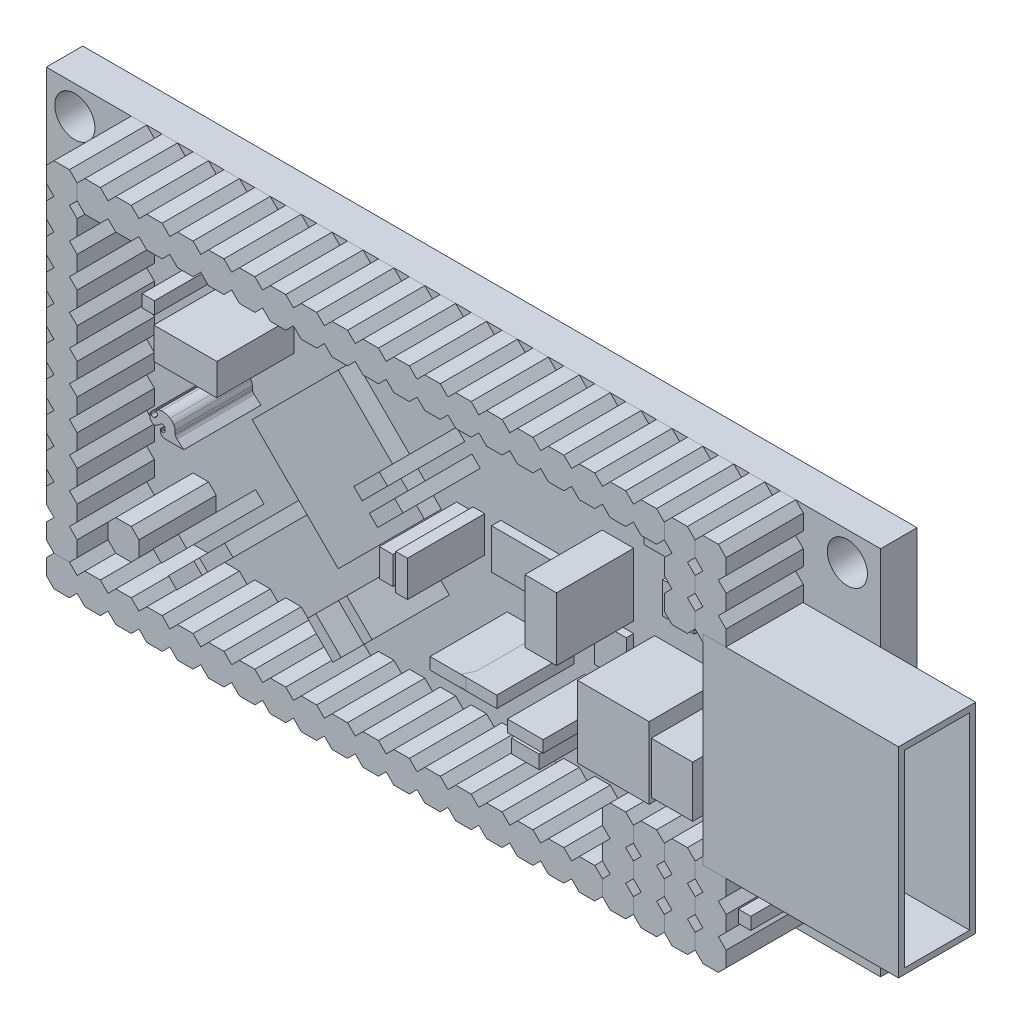
from build123d import *

# Parameters (mm, degrees)
SKETCH_1_W                    = 68.58
SKETCH_1_H                    = 30.48
BOARD_DEPTH                   = 3
F_0402_CAP_1_DEPTH            = 6.35
F_0402_CAP_2_DEPTH            = 6.35
F_0402_CAP_3_DEPTH            = 6.35
F_0402_CAP_4_DEPTH            = 6.35
F_0402_CAP_5_DEPTH            = 6.35
SKETCH_7_W                    = 2.5908
SKETCH_7_H                    = 3.2004
EXTRUDE_1210_1_DEPTH          = 0.6096
SKETCH_8_W                    = 5.1816
SKETCH_8_H                    = 2.5908
EIA3216_1_DEPTH               = 6.35
SKETCH_9_W                    = 2.5908
SKETCH_9_H                    = 5.1816
EIA3216_2_DEPTH               = 6.35
SKETCH_10_W                   = 2.5908
SKETCH_10_H                   = 3.2004
EXTRUDE_1210_2_DEPTH          = 0.6096
SKETCH_11_W                   = 2.5908
SKETCH_11_H                   = 1.3716
EXTRUDE_0805_1_DEPTH          = 0.6096
SKETCH_12_W                   = 6.5532
SKETCH_12_H                   = 3.302
SOT223_1_DEPTH                = 0.762
EXTRUDE_1X19_1_DEPTH          = 6.35
EXTRUDE_1X03_1_DEPTH          = 6.35
EXTRUDE_1X03_2_DEPTH          = 6.35
EXTRUDE_1X03_3_DEPTH          = 6.35
EXTRUDE_1X03_4_DEPTH          = 6.35
EXTRUDE_1X03_5_DEPTH          = 6.35
SKETCH_19_W                   = 1.016
SKETCH_19_H                   = 1.016
FIDUCIAL_1X2_1_DEPTH          = 6.35
EXTRUDE_1X18_1_DEPTH          = 6.35
EXTRUDE_1X11_1_DEPTH          = 6.35
EXTRUDE_1X01_1_DEPTH          = 6.35
SFE_LOGO_FLAME_1_DEPTH        = 6.35
EXTRUDE_1X03_6_DEPTH          = 6.35
SKETCH_30_W                   = 1.016
SKETCH_30_H                   = 1.016
FIDUCIAL_1X2_2_DEPTH          = 6.35
SKETCH_32_W                   = 5.8928
SKETCH_32_H                   = 5.8928
SRU5028_1_DEPTH               = 6.35
SKETCH_33_W                   = 1.1176
SKETCH_33_H                   = 2.286
LED_0603_1_DEPTH              = 6.35
SKETCH_34_W                   = 2.286
SKETCH_34_H                   = 1.1176
LED_0603_2_DEPTH              = 6.35
F_0402_RES_1_DEPTH            = 6.35
SKETCH_36_W                   = 3.4036
SKETCH_36_H                   = 4.2164
TRIMPOT_3MM_1_DEPTH           = 6.35
SKETCH_37_W                   = 2.9464
SKETCH_37_H                   = 0.9652
F_0402_RES_2_DEPTH            = 6.35
SKETCH_38_W                   = 2.9464
SKETCH_38_H                   = 0.9652
F_0402_RES_3_DEPTH            = 6.35
SKETCH_39_W                   = 0.9652
SKETCH_39_H                   = 2.9464
F_0402_RES_4_DEPTH            = 6.35
F_0402_RES_5_DEPTH            = 6.35
SKETCH_41_W                   = 2.9464
SKETCH_41_H                   = 0.9652
F_0402_RES_6_DEPTH            = 6.35
PIC24FXXX_TQFP64_1_DEPTH      = 1.397
SKETCH_44_W                   = 2.5908
SKETCH_44_H                   = 2.5908
QFN16_4X4_1_DEPTH             = 0.9906
SKETCH_45_W                   = 16.0782
SKETCH_45_H                   = 16.4592
USB_A_S_NOSILK_FEMALE_1_DEPTH = 6.35
SKETCH_47_W                   = 5.35
SKETCH_47_H                   = 15.4846
CUT_EXTRUDE_1_DEPTH           = 14.0782
SKETCH_50_R                   = 1.65
CUT_EXTRUDE_2_DEPTH           = 152.087441537
PATTERN_LINEAR_1_COUNT        = 2
PATTERN_LINEAR_1_PITCH        = 63.5
PATTERN_LINEAR_1_COUNT_DIR2   = 2
PATTERN_LINEAR_1_PITCH_DIR2   = 25.4


with BuildPart() as part:
    # 스케치1 → BOARD (new body)
    with BuildSketch(Plane.XY):
        with Locations((85.09, 66.04)):
            Rectangle(SKETCH_1_W, SKETCH_1_H)
    extrude(amount=BOARD_DEPTH)

    # 스케치50 → 컷-돌출2 (cut, through all)
    with BuildSketch(Plane.XY.offset(3)):
        with Locations((53.15, 78.93)):
            Circle(SKETCH_50_R)
    cut_extrude_2 = extrude(amount=-CUT_EXTRUDE_2_DEPTH, mode=Mode.SUBTRACT)

    # 선형 패턴1: Cut-Extrude 2 2 × 2
    with Locations(*[(i * PATTERN_LINEAR_1_PITCH, -j * PATTERN_LINEAR_1_PITCH_DIR2, 0) for i in range(PATTERN_LINEAR_1_COUNT) for j in range(PATTERN_LINEAR_1_COUNT_DIR2) if (i, j) != (0, 0)]):
        add(cut_extrude_2, mode=Mode.SUBTRACT)


with BuildPart() as body_2:
    # 스케치2 → 0402-CAP-1 (new body)
    with BuildSketch(Plane.XY.offset(3)):
        Polygon((81.849540023, 62.342959443), (83.932959443, 60.259540023), (83.250459977, 59.577040557), (81.167040557, 61.660459977), align=None)
    extrude(amount=F_0402_CAP_1_DEPTH)


with BuildPart() as body_3:
    # 스케치3 → 0402-CAP-2 (new body)
    with BuildSketch(Plane.XY.offset(3)):
        Polygon((82.437040557, 70.419540023), (84.520459977, 72.502959443), (85.202959443, 71.820459977), (83.119540023, 69.737040557), align=None)
    extrude(amount=F_0402_CAP_2_DEPTH)


with BuildPart() as body_4:
    # 스케치4 → 0402-CAP-3 (new body)
    with BuildSketch(Plane.XY.offset(3)):
        Polygon((79.309540023, 59.802959443), (81.392959443, 57.719540023), (80.710459977, 57.037040557), (78.627040557, 59.120459977), align=None)
    extrude(amount=F_0402_CAP_3_DEPTH)


with BuildPart() as body_5:
    # 스케치5 → 0402-CAP-4 (new body)
    with BuildSketch(Plane.XY.offset(3)):
        Polygon((72.502959443, 60.390459977), (70.419540023, 58.307040557), (69.737040557, 58.989540023), (71.820459977, 61.072959443), align=None)
    extrude(amount=F_0402_CAP_4_DEPTH)


with BuildPart() as body_6:
    # 스케치6 → 0402-CAP-5 (new body)
    with BuildSketch(Plane.XY.offset(3)):
        Polygon((83.707040557, 69.149540023), (85.790459977, 71.232959443), (86.472959443, 70.550459977), (84.389540023, 68.467040557), align=None)
    extrude(amount=F_0402_CAP_5_DEPTH)


with BuildPart() as body_7:
    # 스케치7 → 1210-1 (new body)
    with BuildSketch(Plane.XY.offset(3)):
        with Locations((108.585, 68.326)):
            Rectangle(SKETCH_7_W, SKETCH_7_H)
    extrude(amount=EXTRUDE_1210_1_DEPTH)


with BuildPart() as body_8:
    # 스케치8 → EIA3216-1 (new body)
    with BuildSketch(Plane.XY.offset(3)):
        with Locations((68.58, 72.39)):
            Rectangle(SKETCH_8_W, SKETCH_8_H)
    extrude(amount=EIA3216_1_DEPTH)


with BuildPart() as body_9:
    # 스케치9 → EIA3216-2 (new body)
    with BuildSketch(Plane.XY.offset(3)):
        with Locations((97.79, 68.58)):
            Rectangle(SKETCH_9_W, SKETCH_9_H)
    extrude(amount=EIA3216_2_DEPTH)


with BuildPart() as body_10:
    # 스케치10 → 1210-2 (new body)
    with BuildSketch(Plane.XY.offset(3)):
        with Locations((97.79, 63.5)):
            Rectangle(SKETCH_10_W, SKETCH_10_H)
    extrude(amount=EXTRUDE_1210_2_DEPTH)


with BuildPart() as body_11:
    # 스케치11 → 0805-1 (new body)
    with BuildSketch(Plane.XY.offset(3)):
        with Locations((101.854, 73.152)):
            Rectangle(SKETCH_11_W, SKETCH_11_H)
    extrude(amount=EXTRUDE_0805_1_DEPTH)


with BuildPart() as body_12:
    # 스케치12 → SOT223-1 (new body)
    with BuildSketch(Plane.XY.offset(3)):
        with Locations((91.44, 66.04)):
            Rectangle(SKETCH_12_W, SKETCH_12_H)
    extrude(amount=SOT223_1_DEPTH)


with BuildPart() as body_13:
    # 스케치13 → 1X19-1 (new body)
    with BuildSketch(Plane.XY.offset(3)):
        Polygon((87.63, 80.645), (88.265, 81.28), (89.535, 81.28), (90.17, 80.645), (90.805, 81.28), (92.075, 81.28), (92.71, 80.645), (93.345, 81.28), (94.615, 81.28), (95.25, 80.645), (95.885, 81.28), (97.155, 81.28), (97.79, 80.645), (98.425, 81.28), (99.695, 81.28), (100.33, 80.645), (100.965, 81.28), (102.235, 81.28), (102.87, 80.645), (103.505, 81.28), (104.775, 81.28), (105.41, 80.645), (106.045, 81.28), (107.315, 81.28), (107.95, 80.645), (107.95, 79.375), (107.315, 78.74), (106.045, 78.74), (105.41, 79.375), (104.775, 78.74), (103.505, 78.74), (102.87, 79.375), (102.235, 78.74), (100.965, 78.74), (100.33, 79.375), (99.695, 78.74), (98.425, 78.74), (97.79, 79.375), (97.155, 78.74), (95.885, 78.74), (95.25, 79.375), (94.615, 78.74), (93.345, 78.74), (92.71, 79.375), (92.075, 78.74), (90.805, 78.74), (90.17, 79.375), (89.535, 78.74), (88.265, 78.74), (87.63, 79.375), (86.995, 78.74), (85.725, 78.74), (85.09, 79.375), (84.455, 78.74), (83.185, 78.74), (82.55, 79.375), (81.915, 78.74), (80.645, 78.74), (80.01, 79.375), (79.375, 78.74), (78.105, 78.74), (77.47, 79.375), (76.835, 78.74), (75.565, 78.74), (74.93, 79.375), (74.295, 78.74), (73.025, 78.74), (72.39, 79.375), (71.755, 78.74), (70.485, 78.74), (69.85, 79.375), (69.215, 78.74), (67.945, 78.74), (67.31, 79.375), (66.675, 78.74), (65.405, 78.74), (64.77, 79.375), (64.135, 78.74), (62.865, 78.74), (62.23, 79.375), (61.595, 78.74), (60.325, 78.74), (59.69, 79.375), (59.69, 80.645), (60.325, 81.28), (61.595, 81.28), (62.23, 80.645), (62.865, 81.28), (64.135, 81.28), (64.77, 80.645), (65.405, 81.28), (66.675, 81.28), (67.31, 80.645), (67.945, 81.28), (69.215, 81.28), (69.85, 80.645), (70.485, 81.28), (71.755, 81.28), (72.39, 80.645), (73.025, 81.28), (74.295, 81.28), (74.93, 80.645), (75.565, 81.28), (76.835, 81.28), (77.47, 80.645), (78.105, 81.28), (79.375, 81.28), (80.01, 80.645), (80.645, 81.28), (81.915, 81.28), (82.55, 80.645), (83.185, 81.28), (84.455, 81.28), (85.09, 80.645), (85.725, 81.28), (86.995, 81.28), align=None)
    extrude(amount=EXTRUDE_1X19_1_DEPTH)


with BuildPart() as body_14:
    # 스케치14 → 1X03-1 (new body)
    with BuildSketch(Plane.XY.offset(3)):
        Polygon((107.95, 79.375), (107.95, 80.645), (108.585, 81.28), (109.855, 81.28), (110.49, 80.645), (110.49, 79.375), (109.855, 78.74), (110.49, 78.105), (110.49, 76.835), (109.855, 76.2), (110.49, 75.565), (110.49, 74.295), (109.855, 73.66), (108.585, 73.66), (107.95, 74.295), (107.95, 75.565), (108.585, 76.2), (107.95, 76.835), (107.95, 78.105), (108.585, 78.74), align=None)
    extrude(amount=EXTRUDE_1X03_1_DEPTH)


with BuildPart() as body_15:
    # 스케치15 → 1X03-2 (new body)
    with BuildSketch(Plane.XY.offset(3)):
        Polygon((113.03, 75.565), (113.03, 74.295), (112.395, 73.66), (111.125, 73.66), (110.49, 74.295), (110.49, 75.565), (111.125, 76.2), (110.49, 76.835), (110.49, 78.105), (111.125, 78.74), (110.49, 79.375), (110.49, 80.645), (111.125, 81.28), (112.395, 81.28), (113.03, 80.645), (113.03, 79.375), (112.395, 78.74), (113.03, 78.105), (113.03, 76.835), (112.395, 76.2), align=None)
    extrude(amount=EXTRUDE_1X03_2_DEPTH)


with BuildPart() as body_16:
    # 스케치16 → 1X03-3 (new body)
    with BuildSketch(Plane.XY.offset(3)):
        Polygon((110.49, 56.515), (110.49, 57.785), (111.125, 58.42), (112.395, 58.42), (113.03, 57.785), (113.03, 56.515), (112.395, 55.88), (113.03, 55.245), (113.03, 53.975), (112.395, 53.34), (113.03, 52.705), (113.03, 51.435), (112.395, 50.8), (111.125, 50.8), (110.49, 51.435), (110.49, 52.705), (111.125, 53.34), (110.49, 53.975), (110.49, 55.245), (111.125, 55.88), align=None)
    extrude(amount=EXTRUDE_1X03_3_DEPTH)


with BuildPart() as body_17:
    # 스케치17 → 1X03-4 (new body)
    with BuildSketch(Plane.XY.offset(3)):
        Polygon((105.41, 56.515), (105.41, 57.785), (106.045, 58.42), (107.315, 58.42), (107.95, 57.785), (107.95, 56.515), (107.315, 55.88), (107.95, 55.245), (107.95, 53.975), (107.315, 53.34), (107.95, 52.705), (107.95, 51.435), (107.315, 50.8), (106.045, 50.8), (105.41, 51.435), (105.41, 52.705), (106.045, 53.34), (105.41, 53.975), (105.41, 55.245), (106.045, 55.88), align=None)
    extrude(amount=EXTRUDE_1X03_4_DEPTH)


with BuildPart() as body_18:
    # 스케치18 → 1X03-5 (new body)
    with BuildSketch(Plane.XY.offset(3)):
        Polygon((107.95, 56.515), (107.95, 57.785), (108.585, 58.42), (109.855, 58.42), (110.49, 57.785), (110.49, 56.515), (109.855, 55.88), (110.49, 55.245), (110.49, 53.975), (109.855, 53.34), (110.49, 52.705), (110.49, 51.435), (109.855, 50.8), (108.585, 50.8), (107.95, 51.435), (107.95, 52.705), (108.585, 53.34), (107.95, 53.975), (107.95, 55.245), (108.585, 55.88), align=None)
    extrude(amount=EXTRUDE_1X03_5_DEPTH)


with BuildPart() as body_19:
    # 스케치19 → FIDUCIAL-1X2-1 (new body)
    with BuildSketch(Plane.XY.offset(3)):
        with Locations((114.554, 55.626)):
            Rectangle(SKETCH_19_W, SKETCH_19_H)
    extrude(amount=FIDUCIAL_1X2_1_DEPTH)


with BuildPart() as body_20:
    # 스케치21 → 1X18-1 (new body)
    with BuildSketch(Plane.XY.offset(3)):
        Polygon((82.55, 52.705), (83.185, 53.34), (84.455, 53.34), (85.09, 52.705), (85.725, 53.34), (86.995, 53.34), (87.63, 52.705), (88.265, 53.34), (89.535, 53.34), (90.17, 52.705), (90.805, 53.34), (92.075, 53.34), (92.71, 52.705), (93.345, 53.34), (94.615, 53.34), (95.25, 52.705), (95.885, 53.34), (97.155, 53.34), (97.79, 52.705), (98.425, 53.34), (99.695, 53.34), (100.33, 52.705), (100.965, 53.34), (102.235, 53.34), (102.87, 52.705), (102.87, 51.435), (102.235, 50.8), (100.965, 50.8), (100.33, 51.435), (99.695, 50.8), (98.425, 50.8), (97.79, 51.435), (97.155, 50.8), (95.885, 50.8), (95.25, 51.435), (94.615, 50.8), (93.345, 50.8), (92.71, 51.435), (92.075, 50.8), (90.805, 50.8), (90.17, 51.435), (89.535, 50.8), (88.265, 50.8), (87.63, 51.435), (86.995, 50.8), (85.725, 50.8), (85.09, 51.435), (84.455, 50.8), (83.185, 50.8), (82.55, 51.435), (81.915, 50.8), (80.645, 50.8), (80.01, 51.435), (79.375, 50.8), (78.105, 50.8), (77.47, 51.435), (76.835, 50.8), (75.565, 50.8), (74.93, 51.435), (74.295, 50.8), (73.025, 50.8), (72.39, 51.435), (71.755, 50.8), (70.485, 50.8), (69.85, 51.435), (69.215, 50.8), (67.945, 50.8), (67.31, 51.435), (66.675, 50.8), (65.405, 50.8), (64.77, 51.435), (64.135, 50.8), (62.865, 50.8), (62.23, 51.435), (61.595, 50.8), (60.325, 50.8), (59.69, 51.435), (59.055, 50.8), (57.785, 50.8), (57.15, 51.435), (57.15, 52.705), (57.785, 53.34), (59.055, 53.34), (59.69, 52.705), (60.325, 53.34), (61.595, 53.34), (62.23, 52.705), (62.865, 53.34), (64.135, 53.34), (64.77, 52.705), (65.405, 53.34), (66.675, 53.34), (67.31, 52.705), (67.945, 53.34), (69.215, 53.34), (69.85, 52.705), (70.485, 53.34), (71.755, 53.34), (72.39, 52.705), (73.025, 53.34), (74.295, 53.34), (74.93, 52.705), (75.565, 53.34), (76.835, 53.34), (77.47, 52.705), (78.105, 53.34), (79.375, 53.34), (80.01, 52.705), (80.645, 53.34), (81.915, 53.34), align=None)
    extrude(amount=EXTRUDE_1X18_1_DEPTH)


with BuildPart() as body_21:
    # 스케치26 → 1X11-1 (new body)
    with BuildSketch(Plane.XY.offset(3)):
        Polygon((59.69, 78.105), (59.055, 78.74), (59.69, 79.375), (59.69, 80.645), (59.055, 81.28), (57.785, 81.28), (57.15, 80.645), (57.15, 79.375), (57.785, 78.74), (57.15, 78.105), (57.15, 76.835), (57.785, 76.2), (57.15, 75.565), (57.15, 74.295), (57.785, 73.66), (57.15, 73.025), (57.15, 71.755), (57.785, 71.12), (57.15, 70.485), (57.15, 69.215), (57.785, 68.58), (57.15, 67.945), (57.15, 66.675), (57.785, 66.04), (57.15, 65.405), (57.15, 64.135), (57.785, 63.5), (57.15, 62.865), (57.15, 61.595), (57.785, 60.96), (57.15, 60.325), (57.15, 59.055), (57.785, 58.42), (57.15, 57.785), (57.15, 56.515), (57.785, 55.88), (57.15, 55.245), (57.15, 53.975), (57.785, 53.34), (59.055, 53.34), (59.69, 53.975), (59.69, 55.245), (59.055, 55.88), (59.69, 56.515), (59.69, 57.785), (59.055, 58.42), (59.69, 59.055), (59.69, 60.325), (59.055, 60.96), (59.69, 61.595), (59.69, 62.865), (59.055, 63.5), (59.69, 64.135), (59.69, 65.405), (59.055, 66.04), (59.69, 66.675), (59.69, 67.945), (59.055, 68.58), (59.69, 69.215), (59.69, 70.485), (59.055, 71.12), (59.69, 71.755), (59.69, 73.025), (59.055, 73.66), (59.69, 74.295), (59.69, 75.565), (59.055, 76.2), (59.69, 76.835), align=None)
    extrude(amount=EXTRUDE_1X11_1_DEPTH)


with BuildPart() as body_22:
    # 스케치27 → 1X01-1 (new body)
    with BuildSketch(Plane.XY.offset(3)):
        Polygon((64.77, 56.515), (64.77, 57.785), (64.135, 58.42), (62.865, 58.42), (62.23, 57.785), (62.23, 56.515), (62.865, 55.88), (64.135, 55.88), align=None)
    extrude(amount=EXTRUDE_1X01_1_DEPTH)


with BuildPart() as body_23:
    # 스케치28 → SFE-LOGO-FLAME-1 (new body)
    with BuildSketch(Plane.XY.offset(3)):
        with BuildLine():
            Line((66.548, 66.5988), (66.548, 66.548))
            ThreePointArc((66.548, 66.548), (66.540449816, 66.4464), (66.548, 66.3448))
            ThreePointArc((66.548, 66.3448), (66.600945402, 66.214996935), (66.7004, 66.1162))
            ThreePointArc((66.7004, 66.1162), (66.808835849, 66.060507547), (66.929, 66.04))
            Line((66.929, 66.04), (68.453, 66.04))
            Line((68.453, 66.04), (67.8942, 66.5226))
            ThreePointArc((67.8942, 66.5226), (67.820469418, 66.617805886), (67.7672, 66.7258))
            ThreePointArc((67.7672, 66.7258), (67.751334134, 66.762844711), (67.7418, 66.802))
            Line((67.7418, 66.802), (67.7418, 67.0306))
            ThreePointArc((67.7418, 67.0306), (67.716925912, 67.228013577), (67.6402, 67.4116))
            ThreePointArc((67.6402, 67.4116), (67.503817885, 67.580017885), (67.3354, 67.7164))
            ThreePointArc((67.3354, 67.7164), (66.983175739, 67.871899489), (66.5988, 67.8942))
            ThreePointArc((66.5988, 67.8942), (66.453536495, 67.858699638), (66.3194, 67.7926))
            ThreePointArc((66.3194, 67.7926), (66.20712141, 67.70167859), (66.1162, 67.5894))
            Line((66.1162, 67.5894), (66.1924, 67.5894))
            ThreePointArc((66.1924, 67.5894), (66.2051, 67.591071987), (66.2178, 67.5894))
            ThreePointArc((66.2178, 67.5894), (66.261424237, 67.556824237), (66.294, 67.5132))
            ThreePointArc((66.294, 67.5132), (66.294610025, 67.5005), (66.294, 67.4878))
            ThreePointArc((66.294, 67.4878), (66.297844642, 67.40884256), (66.2686, 67.3354))
            Line((66.2686, 67.3354), (66.1924, 67.2338))
            ThreePointArc((66.1924, 67.2338), (66.157131319, 67.192868681), (66.1162, 67.1576))
            ThreePointArc((66.1162, 67.1576), (66.067399023, 67.128201953), (66.0146, 67.1068))
            ThreePointArc((66.0146, 67.1068), (65.9892, 67.103793712), (65.9638, 67.1068))
            ThreePointArc((65.9638, 67.1068), (65.857885226, 67.146479317), (65.786, 67.2338))
            ThreePointArc((65.786, 67.2338), (65.769301953, 67.283600488), (65.7606, 67.3354))
            ThreePointArc((65.7606, 67.3354), (65.760101244, 67.3735), (65.7606, 67.4116))
            ThreePointArc((65.7606, 67.4116), (65.728962544, 67.363918728), (65.7098, 67.31))
            ThreePointArc((65.7098, 67.31), (65.697821158, 67.296578842), (65.6844, 67.2846))
            ThreePointArc((65.6844, 67.2846), (65.683789975, 67.2719), (65.6844, 67.2592))
            ThreePointArc((65.6844, 67.2592), (65.665093589, 67.171243773), (65.659, 67.0814))
            ThreePointArc((65.659, 67.0814), (65.665985876, 66.950717175), (65.7098, 66.8274))
            ThreePointArc((65.7098, 66.8274), (65.768305588, 66.74703799), (65.8368, 66.675))
            ThreePointArc((65.8368, 66.675), (66.01047352, 66.604529278), (66.1924, 66.6496))
            ThreePointArc((66.1924, 66.6496), (66.367495117, 66.763606348), (66.5226, 66.9036))
            ThreePointArc((66.5226, 66.9036), (66.706594204, 66.977618854), (66.8782, 66.8782))
            ThreePointArc((66.8782, 66.8782), (66.914515547, 66.792418728), (66.929, 66.7004))
            ThreePointArc((66.929, 66.7004), (66.922430447, 66.594092388), (66.8782, 66.4972))
            ThreePointArc((66.8782, 66.4972), (66.845454606, 66.453745394), (66.802, 66.421))
            ThreePointArc((66.802, 66.421), (66.7258, 66.408590042), (66.6496, 66.421))
            ThreePointArc((66.6496, 66.421), (66.634945283, 66.431745283), (66.6242, 66.4464))
            ThreePointArc((66.6242, 66.4464), (66.599021658, 66.497310829), (66.5734, 66.548))
            ThreePointArc((66.5734, 66.548), (66.555068956, 66.570584478), (66.548, 66.5988))
        make_face()
    extrude(amount=SFE_LOGO_FLAME_1_DEPTH)


with BuildPart() as body_24:
    # 스케치29 → 1X03-6 (new body)
    with BuildSketch(Plane.XY.offset(3)):
        Polygon((105.41, 52.705), (105.41, 51.435), (104.775, 50.8), (103.505, 50.8), (102.87, 51.435), (102.87, 52.705), (103.505, 53.34), (102.87, 53.975), (102.87, 55.245), (103.505, 55.88), (102.87, 56.515), (102.87, 57.785), (103.505, 58.42), (104.775, 58.42), (105.41, 57.785), (105.41, 56.515), (104.775, 55.88), (105.41, 55.245), (105.41, 53.975), (104.775, 53.34), align=None)
    extrude(amount=EXTRUDE_1X03_6_DEPTH)


with BuildPart() as body_25:
    # 스케치30 → FIDUCIAL-1X2-2 (new body)
    with BuildSketch(Plane.XY.offset(3)):
        with Locations((65.532, 74.93)):
            Rectangle(SKETCH_30_W, SKETCH_30_H)
    extrude(amount=FIDUCIAL_1X2_2_DEPTH)


with BuildPart() as body_26:
    # 스케치32 → SRU5028-1 (new body)
    with BuildSketch(Plane.XY.offset(3)):
        with Locations((103.759, 62.865)):
            Rectangle(SKETCH_32_W, SKETCH_32_H)
    extrude(amount=SRU5028_1_DEPTH)


with BuildPart() as body_27:
    # 스케치33 → LED-0603-1 (new body)
    with BuildSketch(Plane.XY.offset(3)):
        with Locations((85.09, 66.04)):
            Rectangle(SKETCH_33_W, SKETCH_33_H)
    extrude(amount=LED_0603_1_DEPTH)


with BuildPart() as body_28:
    # 스케치34 → LED-0603-2 (new body)
    with BuildSketch(Plane.XY.offset(3)):
        with Locations((96.52, 58.42)):
            Rectangle(SKETCH_34_W, SKETCH_34_H)
    extrude(amount=LED_0603_2_DEPTH)


with BuildPart() as body_29:
    # 스케치35 → 0402-RES-1 (new body)
    with BuildSketch(Plane.XY.offset(3)):
        Polygon((67.197040557, 56.449540023), (69.280459977, 58.532959443), (69.962959443, 57.850459977), (67.879540023, 55.767040557), align=None)
    extrude(amount=F_0402_RES_1_DEPTH)


with BuildPart() as body_30:
    # 스케치36 → TRIMPOT-3MM-1 (new body)
    with BuildSketch(Plane.XY.offset(3)):
        with Locations((108.585, 62.611)):
            Rectangle(SKETCH_36_W, SKETCH_36_H)
    extrude(amount=TRIMPOT_3MM_1_DEPTH)


with BuildPart() as body_31:
    # 스케치37 → 0402-RES-2 (new body)
    with BuildSketch(Plane.XY.offset(3)):
        with Locations((90.17, 60.96)):
            Rectangle(SKETCH_37_W, SKETCH_37_H)
    extrude(amount=F_0402_RES_2_DEPTH)


with BuildPart() as body_32:
    # 스케치38 → 0402-RES-3 (new body)
    with BuildSketch(Plane.XY.offset(3)):
        with Locations((92.71, 60.96)):
            Rectangle(SKETCH_38_W, SKETCH_38_H)
    extrude(amount=F_0402_RES_3_DEPTH)


with BuildPart() as body_33:
    # 스케치39 → 0402-RES-4 (new body)
    with BuildSketch(Plane.XY.offset(3)):
        with Locations((86.36, 66.04)):
            Rectangle(SKETCH_39_W, SKETCH_39_H)
    extrude(amount=F_0402_RES_4_DEPTH)


with BuildPart() as body_34:
    # 스케치40 → 0402-RES-5 (new body)
    with BuildSketch(Plane.XY.offset(3)):
        Polygon((68.692959443, 59.120459977), (66.609540023, 57.037040557), (65.927040557, 57.719540023), (68.010459977, 59.802959443), align=None)
    extrude(amount=F_0402_RES_5_DEPTH)


with BuildPart() as body_35:
    # 스케치41 → 0402-RES-6 (new body)
    with BuildSketch(Plane.XY.offset(3)):
        with Locations((96.52, 59.69)):
            Rectangle(SKETCH_41_W, SKETCH_41_H)
    extrude(amount=F_0402_RES_6_DEPTH)


with BuildPart() as body_36:
    # 스케치43 → PIC24FXXX_TQFP64-1 (new body)
    with BuildSketch(Plane.XY.offset(3)):
        Polygon((76.2, 73.116441823), (83.276441823, 66.04), (76.2, 58.963558177), (69.123558177, 66.04), align=None)
    extrude(amount=PIC24FXXX_TQFP64_1_DEPTH)


with BuildPart() as body_37:
    # 스케치44 → QFN16-4X4-1 (new body)
    with BuildSketch(Plane.XY.offset(3)):
        with Locations((103.759, 69.8246)):
            Rectangle(SKETCH_44_W, SKETCH_44_H)
    extrude(amount=QFN16_4X4_1_DEPTH)


with BuildPart() as body_38:
    # 스케치45 → USB-A-S-NOSILK-FEMALE-1 (new body)
    with BuildSketch(Plane.XY.offset(3)):
        with Locations((119.1641, 66.04)):
            Rectangle(SKETCH_45_W, SKETCH_45_H)
    extrude(amount=USB_A_S_NOSILK_FEMALE_1_DEPTH)

    # 스케치47 → 컷-돌출1 (cut)
    with BuildSketch(Plane(origin=(127.2032, 0, 0), x_dir=(0, 0, -1), z_dir=(1, 0, 0))):
        with Locations((-6.175, 66.0273)):
            Rectangle(SKETCH_47_W, SKETCH_47_H)
    extrude(amount=-CUT_EXTRUDE_1_DEPTH, mode=Mode.SUBTRACT)


solid = Compound([part.part, body_2.part, body_3.part, body_4.part, body_5.part, body_6.part, body_7.part, body_8.part, body_9.part, body_10.part, body_11.part, body_12.part, body_13.part, body_14.part, body_15.part, body_16.part, body_17.part, body_18.part, body_19.part, body_20.part, body_21.part, body_22.part, body_23.part, body_24.part, body_25.part, body_26.part, body_27.part, body_28.part, body_29.part, body_30.part, body_31.part, body_32.part, body_33.part, body_34.part, body_35.part, body_36.part, body_37.part, body_38.part])
